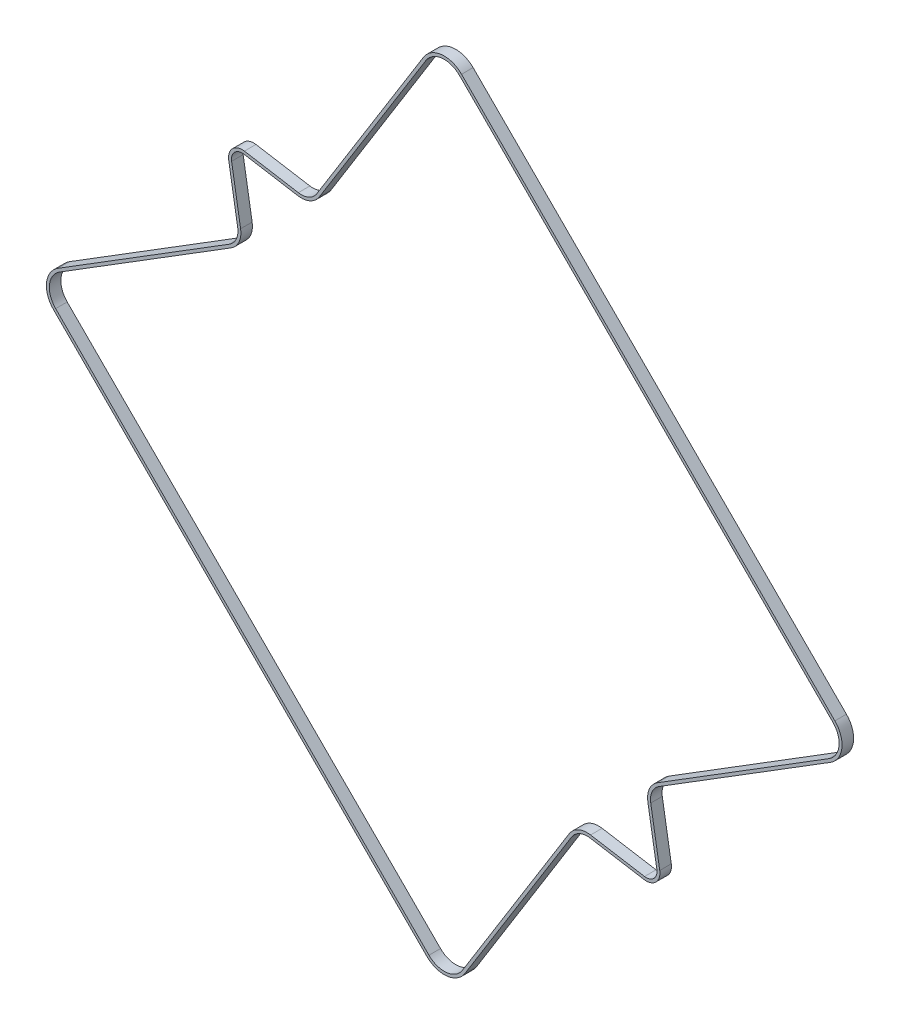
from build123d import *

# Parameters (mm, degrees)
EXTRUDE_THIN1_DEPTH = 6


with BuildPart() as part:
    # Sketch2 → Extrude-Thin1 (new body)
    with BuildSketch(Plane.XY):
        with BuildLine():
            Line((111.66639433, -260.195863238), (200.724658676, -204.813707436))
            ThreePointArc((200.724658676, -204.813707436), (206.650676138, -195.455230586), (203.004368462, -184.995631538))
            Line((203.004368462, -184.995631538), (9.004368462, 9.004368462))
            ThreePointArc((9.004368462, 9.004368462), (-1.455230586, 12.650676138), (-10.813707436, 6.724658676))
            Line((-10.813707436, 6.724658676), (-66.195863238, -82.33360567))
            ThreePointArc((-66.195863238, -82.33360567), (-70.339982749, -85.965191756), (-75.80379702, -86.678548357))
            Line((-75.80379702, -86.678548357), (-103.841686571, -82.008393831))
            ThreePointArc((-103.841686571, -82.008393831), (-110.013440784, -83.986559216), (-111.991606169, -90.158313429))
            Line((-111.991606169, -90.158313429), (-107.321451643, -118.19620298))
            ThreePointArc((-107.321451643, -118.19620298), (-108.034808244, -123.660017251), (-111.66639433, -127.804136762))
            Line((-111.66639433, -127.804136762), (-200.724658676, -183.186292564))
            ThreePointArc((-200.724658676, -183.186292564), (-206.650676138, -192.544769414), (-203.004368462, -203.004368462))
            Line((-203.004368462, -203.004368462), (-9.004368462, -397.004368462))
            ThreePointArc((-9.004368462, -397.004368462), (1.455230586, -400.650676138), (10.813707436, -394.724658676))
            Line((10.813707436, -394.724658676), (66.195863238, -305.66639433))
            ThreePointArc((66.195863238, -305.66639433), (70.339982749, -302.034808244), (75.80379702, -301.321451643))
            Line((75.80379702, -301.321451643), (103.841686571, -305.991606169))
            ThreePointArc((103.841686571, -305.991606169), (110.013440784, -304.013440784), (111.991606169, -297.841686571))
            Line((111.991606169, -297.841686571), (107.321451643, -269.80379702))
            ThreePointArc((107.321451643, -269.80379702), (108.034808244, -264.339982749), (111.66639433, -260.195863238))
        make_face()
        with BuildLine():
            Line((110.863708534, -258.905090014), (199.92197288, -203.522934212))
            ThreePointArc((199.92197288, -203.522934212), (205.140633989, -195.281527655), (201.929566155, -186.070433845))
            Line((201.929566155, -186.070433845), (7.929566155, 7.929566155))
            ThreePointArc((7.929566155, 7.929566155), (-1.281527655, 11.140633989), (-9.522934212, 5.92197288))
            Line((-9.522934212, 5.92197288), (-64.905090014, -83.136291466))
            ThreePointArc((-64.905090014, -83.136291466), (-69.713667507, -87.350157177), (-76.053536386, -88.177891629))
            Line((-76.053536386, -88.177891629), (-104.091425937, -83.507737103))
            ThreePointArc((-104.091425937, -83.507737103), (-108.938638477, -85.061361523), (-110.492262897, -89.908574063))
            Line((-110.492262897, -89.908574063), (-105.822108371, -117.946463614))
            ThreePointArc((-105.822108371, -117.946463614), (-106.649842823, -124.286332493), (-110.863708534, -129.094909986))
            Line((-110.863708534, -129.094909986), (-199.92197288, -184.477065788))
            ThreePointArc((-199.92197288, -184.477065788), (-205.140633989, -192.718472345), (-201.929566155, -201.929566155))
            Line((-201.929566155, -201.929566155), (-7.929566155, -395.929566155))
            ThreePointArc((-7.929566155, -395.929566155), (1.281527655, -399.140633989), (9.522934212, -393.92197288))
            Line((9.522934212, -393.92197288), (64.905090014, -304.863708534))
            ThreePointArc((64.905090014, -304.863708534), (69.713667507, -300.649842823), (76.053536386, -299.822108371))
            Line((76.053536386, -299.822108371), (104.091425937, -304.492262897))
            ThreePointArc((104.091425937, -304.492262897), (108.938638477, -302.938638477), (110.492262897, -298.091425937))
            Line((110.492262897, -298.091425937), (105.822108371, -270.053536386))
            ThreePointArc((105.822108371, -270.053536386), (106.649842823, -263.713667507), (110.863708534, -258.905090014))
        make_face(mode=Mode.SUBTRACT)
    extrude(amount=EXTRUDE_THIN1_DEPTH)


solid = part.part
